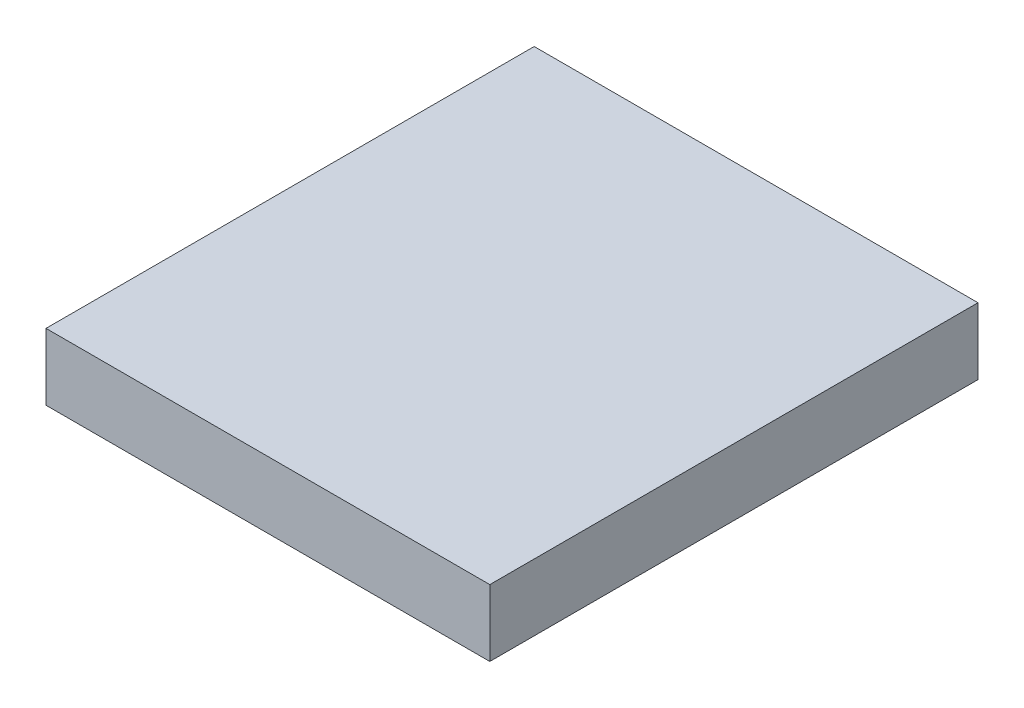
from build123d import *

# Parameters (mm, degrees)
SKETCH1_W          = 15.875
SKETCH1_H          = 17.4625
BASE_FLANGE1_DEPTH = 2.38252


# Sheet-metal steps are written as plain solids
with BuildPart() as part:
    # Sketch1 → Base-Flange1 (new body)
    with BuildSketch(Plane(origin=(0, 0, 0), x_dir=(1, 0, 0), z_dir=(0, 1, 0))):
        Rectangle(SKETCH1_W, SKETCH1_H)
    extrude(amount=-BASE_FLANGE1_DEPTH)


solid = part.part
